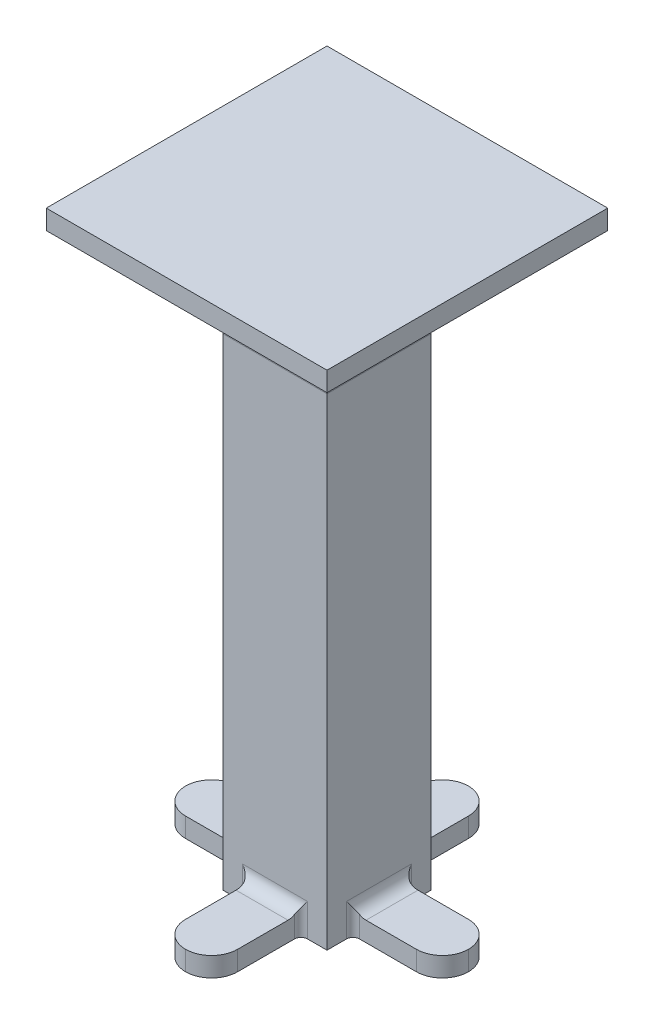
from build123d import *

# Parameters (mm, degrees)
SKETCH1_W           = 10.922
SKETCH1_H           = 12.7
SKETCH1_W_2         = 12.7
SKETCH1_H_2         = 10.922
BOSS_EXTRUDE1_DEPTH = 2.38125
SKETCH2_W           = 12.7
SKETCH2_H           = 12.7
BOSS_EXTRUDE2_DEPTH = 67.3862
SKETCH3_W           = 34.29
SKETCH3_H           = 34.29
BOSS_EXTRUDE3_DEPTH = 2.38125
FILLET15_R          = 10.922
SKETCH4_R           = 5.55625
CUT_EXTRUDE1_DEPTH  = 66.675
CUT_EXTRUDE2_REACH  = 78.171
SKETCH5_W           = 10.922
SKETCH5_H           = 3.175
SKETCH5_W_2         = 3.175
SKETCH5_H_2         = 10.922
FILLET18_R          = 3.175
FILLET28_R          = 0.79375
FILLET29_R          = 1.5875


# Some blends are built 0.0001 mm under size
with BuildPart() as part:
    # Sketch1 → Boss-Extrude1 (new body)
    with BuildSketch(Plane(origin=(0, 0, 0), x_dir=(1, 0, 0), z_dir=(0, 1, 0))):
        with Locations((-11.811, 0)):
            Rectangle(SKETCH1_W, SKETCH1_H)
        Rectangle(SKETCH1_W_2, SKETCH1_H)
        with Locations((0, 11.811)):
            Rectangle(SKETCH1_W_2, SKETCH1_H_2)
        with Locations((11.811, 0)):
            Rectangle(SKETCH1_W, SKETCH1_H)
        with Locations((0, -11.811)):
            Rectangle(SKETCH1_W_2, SKETCH1_H_2)
    extrude(amount=BOSS_EXTRUDE1_DEPTH)

    # Sketch2 → Boss-Extrude2 (add)
    with BuildSketch(Plane(origin=(0, 2.38125, 0), x_dir=(1, 0, 0), z_dir=(0, 1, 0))):
        Rectangle(SKETCH2_W, SKETCH2_H)
    extrude(amount=BOSS_EXTRUDE2_DEPTH)

    # Sketch3 → Boss-Extrude3 (add)
    with BuildSketch(Plane(origin=(0, 69.76745, 0), x_dir=(1, 0, 0), z_dir=(0, 1, 0))):
        Rectangle(SKETCH3_W, SKETCH3_H)
    extrude(amount=BOSS_EXTRUDE3_DEPTH)

    # Fillet15
    # the kernel refuses this fillet: 10.922 mm, written as the material it adds along each edge
    with BuildSketch(Plane(origin=(6.35, 69.76745, 6.35), x_dir=(1, 0, 0), z_dir=(0, 0, -1))) as fillet15_piece_1_section:
        with BuildLine():
            CenterArc((FILLET15_R, FILLET15_R), FILLET15_R, 180, 90)
            Line((0, FILLET15_R), (0, 0))
            Line((0, 0), (FILLET15_R, 0))
        make_face()
    fillet15_piece_1 = extrude(amount=12.7, mode=Mode.PRIVATE)
    fillet15_piece_1 = split(fillet15_piece_1, bisect_by=Plane(origin=(17.145, 67.292403203, 0), z_dir=(-1, 0, 0)), keep=Keep.TOP, mode=Mode.PRIVATE)
    add(fillet15_piece_1)
    with BuildSketch(Plane(origin=(6.35, 69.76745, -6.35), x_dir=(0, 0, -1), z_dir=(-1, 0, 0))) as fillet15_piece_2_section:
        with BuildLine():
            CenterArc((FILLET15_R, FILLET15_R), FILLET15_R, 180, 90)
            Line((0, FILLET15_R), (0, 0))
            Line((0, 0), (FILLET15_R, 0))
        make_face()
    fillet15_piece_2 = extrude(amount=12.7, mode=Mode.PRIVATE)
    fillet15_piece_2 = split(fillet15_piece_2, bisect_by=Plane(origin=(0, 67.292403203, -17.145), z_dir=(0, 0, 1)), keep=Keep.TOP, mode=Mode.PRIVATE)
    add(fillet15_piece_2)
    with BuildSketch(Plane(origin=(-6.35, 69.76745, -6.35), x_dir=(-1, 0, 0), z_dir=(0, 0, 1))) as fillet15_piece_3_section:
        with BuildLine():
            CenterArc((FILLET15_R, FILLET15_R), FILLET15_R, 180, 90)
            Line((0, FILLET15_R), (0, 0))
            Line((0, 0), (FILLET15_R, 0))
        make_face()
    fillet15_piece_3 = extrude(amount=12.7, mode=Mode.PRIVATE)
    fillet15_piece_3 = split(fillet15_piece_3, bisect_by=Plane(origin=(-17.145, 67.292403203, 0), z_dir=(1, 0, 0)), keep=Keep.TOP, mode=Mode.PRIVATE)
    add(fillet15_piece_3)
    with BuildSketch(Plane(origin=(-6.35, 69.76745, 6.35), x_dir=(0, 0, 1), z_dir=(1, 0, 0))) as fillet15_piece_4_section:
        with BuildLine():
            CenterArc((FILLET15_R, FILLET15_R), FILLET15_R, 180, 90)
            Line((0, FILLET15_R), (0, 0))
            Line((0, 0), (FILLET15_R, 0))
        make_face()
    fillet15_piece_4 = extrude(amount=12.7, mode=Mode.PRIVATE)
    fillet15_piece_4 = split(fillet15_piece_4, bisect_by=Plane(origin=(0, 67.292403203, 17.145), z_dir=(0, 0, -1)), keep=Keep.TOP, mode=Mode.PRIVATE)
    add(fillet15_piece_4)
    with BuildSketch(Plane(origin=(-6.35, 69.76745, 6.35), x_dir=(0, 0, 1), z_dir=(1, 0, 0))) as fillet15_piece_5a_section:
        with BuildLine():
            CenterArc((FILLET15_R, FILLET15_R), FILLET15_R, 180, 90)
            Line((0, FILLET15_R), (0, 0))
            Line((0, 0), (FILLET15_R, 0))
        make_face()
    fillet15_piece_5a = extrude(amount=40.005, mode=Mode.PRIVATE)
    fillet15_piece_5a = split(fillet15_piece_5a, bisect_by=Plane(origin=(11.7475, 67.292403203, 17.145), z_dir=(0, 0, -1)), keep=Keep.TOP, mode=Mode.PRIVATE)
    fillet15_piece_5a = split(fillet15_piece_5a, bisect_by=Plane(origin=(17.145, 67.292403203, 8.815024112), z_dir=(-1, 0, 0)), keep=Keep.TOP, mode=Mode.PRIVATE)
    fillet15_piece_5a = split(fillet15_piece_5a, bisect_by=Plane(origin=(6.35, 67.292403203, 8.815024112), z_dir=(1, 0, 0)), keep=Keep.TOP, mode=Mode.PRIVATE)
    with BuildSketch(Plane(origin=(6.35, 69.76745, 33.655), x_dir=(1, 0, 0), z_dir=(0, 0, -1))) as fillet15_piece_5b_section:
        with BuildLine():
            CenterArc((FILLET15_R, FILLET15_R), FILLET15_R, 180, 90)
            Line((0, FILLET15_R), (0, 0))
            Line((0, 0), (FILLET15_R, 0))
        make_face()
    fillet15_piece_5b = extrude(amount=40.005, mode=Mode.PRIVATE)
    fillet15_piece_5b = split(fillet15_piece_5b, bisect_by=Plane(origin=(8.815024112, 67.292403203, 17.145), z_dir=(0, 0, -1)), keep=Keep.TOP, mode=Mode.PRIVATE)
    fillet15_piece_5b = split(fillet15_piece_5b, bisect_by=Plane(origin=(17.145, 67.292403203, 11.7475), z_dir=(-1, 0, 0)), keep=Keep.TOP, mode=Mode.PRIVATE)
    fillet15_piece_5b = split(fillet15_piece_5b, bisect_by=Plane(origin=(8.815024112, 67.292403203, 6.35), z_dir=(0, 0, 1)), keep=Keep.TOP, mode=Mode.PRIVATE)
    fillet15_piece_5 = fillet15_piece_5a & fillet15_piece_5b
    add(fillet15_piece_5)
    with BuildSketch(Plane(origin=(6.35, 69.76745, 6.35), x_dir=(1, 0, 0), z_dir=(0, 0, -1))) as fillet15_piece_6a_section:
        with BuildLine():
            CenterArc((FILLET15_R, FILLET15_R), FILLET15_R, 180, 90)
            Line((0, FILLET15_R), (0, 0))
            Line((0, 0), (FILLET15_R, 0))
        make_face()
    fillet15_piece_6a = extrude(amount=40.005, mode=Mode.PRIVATE)
    fillet15_piece_6a = split(fillet15_piece_6a, bisect_by=Plane(origin=(17.145, 67.292403203, -11.7475), z_dir=(-1, 0, 0)), keep=Keep.TOP, mode=Mode.PRIVATE)
    fillet15_piece_6a = split(fillet15_piece_6a, bisect_by=Plane(origin=(8.815024112, 67.292403203, -17.145), z_dir=(0, 0, 1)), keep=Keep.TOP, mode=Mode.PRIVATE)
    fillet15_piece_6a = split(fillet15_piece_6a, bisect_by=Plane(origin=(8.815024112, 67.292403203, -6.35), z_dir=(0, 0, -1)), keep=Keep.TOP, mode=Mode.PRIVATE)
    with BuildSketch(Plane(origin=(33.655, 69.76745, -6.35), x_dir=(0, 0, -1), z_dir=(-1, 0, 0))) as fillet15_piece_6b_section:
        with BuildLine():
            CenterArc((FILLET15_R, FILLET15_R), FILLET15_R, 180, 90)
            Line((0, FILLET15_R), (0, 0))
            Line((0, 0), (FILLET15_R, 0))
        make_face()
    fillet15_piece_6b = extrude(amount=40.005, mode=Mode.PRIVATE)
    fillet15_piece_6b = split(fillet15_piece_6b, bisect_by=Plane(origin=(17.145, 67.292403203, -8.815024112), z_dir=(-1, 0, 0)), keep=Keep.TOP, mode=Mode.PRIVATE)
    fillet15_piece_6b = split(fillet15_piece_6b, bisect_by=Plane(origin=(11.7475, 67.292403203, -17.145), z_dir=(0, 0, 1)), keep=Keep.TOP, mode=Mode.PRIVATE)
    fillet15_piece_6b = split(fillet15_piece_6b, bisect_by=Plane(origin=(6.35, 67.292403203, -8.815024112), z_dir=(1, 0, 0)), keep=Keep.TOP, mode=Mode.PRIVATE)
    fillet15_piece_6 = fillet15_piece_6a & fillet15_piece_6b
    add(fillet15_piece_6)
    with BuildSketch(Plane(origin=(-6.35, 69.76745, -33.655), x_dir=(-1, 0, 0), z_dir=(0, 0, 1))) as fillet15_piece_7a_section:
        with BuildLine():
            CenterArc((FILLET15_R, FILLET15_R), FILLET15_R, 180, 90)
            Line((0, FILLET15_R), (0, 0))
            Line((0, 0), (FILLET15_R, 0))
        make_face()
    fillet15_piece_7a = extrude(amount=40.005, mode=Mode.PRIVATE)
    fillet15_piece_7a = split(fillet15_piece_7a, bisect_by=Plane(origin=(-17.145, 67.292403203, -11.7475), z_dir=(1, 0, 0)), keep=Keep.TOP, mode=Mode.PRIVATE)
    fillet15_piece_7a = split(fillet15_piece_7a, bisect_by=Plane(origin=(-8.815024112, 67.292403203, -17.145), z_dir=(0, 0, 1)), keep=Keep.TOP, mode=Mode.PRIVATE)
    fillet15_piece_7a = split(fillet15_piece_7a, bisect_by=Plane(origin=(-8.815024112, 67.292403203, -6.35), z_dir=(0, 0, -1)), keep=Keep.TOP, mode=Mode.PRIVATE)
    with BuildSketch(Plane(origin=(6.35, 69.76745, -6.35), x_dir=(0, 0, -1), z_dir=(-1, 0, 0))) as fillet15_piece_7b_section:
        with BuildLine():
            CenterArc((FILLET15_R, FILLET15_R), FILLET15_R, 180, 90)
            Line((0, FILLET15_R), (0, 0))
            Line((0, 0), (FILLET15_R, 0))
        make_face()
    fillet15_piece_7b = extrude(amount=40.005, mode=Mode.PRIVATE)
    fillet15_piece_7b = split(fillet15_piece_7b, bisect_by=Plane(origin=(-17.145, 67.292403203, -8.815024112), z_dir=(1, 0, 0)), keep=Keep.TOP, mode=Mode.PRIVATE)
    fillet15_piece_7b = split(fillet15_piece_7b, bisect_by=Plane(origin=(-11.7475, 67.292403203, -17.145), z_dir=(0, 0, 1)), keep=Keep.TOP, mode=Mode.PRIVATE)
    fillet15_piece_7b = split(fillet15_piece_7b, bisect_by=Plane(origin=(-6.35, 67.292403203, -8.815024112), z_dir=(-1, 0, 0)), keep=Keep.TOP, mode=Mode.PRIVATE)
    fillet15_piece_7 = fillet15_piece_7a & fillet15_piece_7b
    add(fillet15_piece_7)
    with BuildSketch(Plane(origin=(-6.35, 69.76745, -6.35), x_dir=(-1, 0, 0), z_dir=(0, 0, 1))) as fillet15_piece_8a_section:
        with BuildLine():
            CenterArc((FILLET15_R, FILLET15_R), FILLET15_R, 180, 90)
            Line((0, FILLET15_R), (0, 0))
            Line((0, 0), (FILLET15_R, 0))
        make_face()
    fillet15_piece_8a = extrude(amount=40.005, mode=Mode.PRIVATE)
    fillet15_piece_8a = split(fillet15_piece_8a, bisect_by=Plane(origin=(-8.815024112, 67.292403203, 17.145), z_dir=(0, 0, -1)), keep=Keep.TOP, mode=Mode.PRIVATE)
    fillet15_piece_8a = split(fillet15_piece_8a, bisect_by=Plane(origin=(-17.145, 67.292403203, 11.7475), z_dir=(1, 0, 0)), keep=Keep.TOP, mode=Mode.PRIVATE)
    fillet15_piece_8a = split(fillet15_piece_8a, bisect_by=Plane(origin=(-8.815024112, 67.292403203, 6.35), z_dir=(0, 0, 1)), keep=Keep.TOP, mode=Mode.PRIVATE)
    with BuildSketch(Plane(origin=(-33.655, 69.76745, 6.35), x_dir=(0, 0, 1), z_dir=(1, 0, 0))) as fillet15_piece_8b_section:
        with BuildLine():
            CenterArc((FILLET15_R, FILLET15_R), FILLET15_R, 180, 90)
            Line((0, FILLET15_R), (0, 0))
            Line((0, 0), (FILLET15_R, 0))
        make_face()
    fillet15_piece_8b = extrude(amount=40.005, mode=Mode.PRIVATE)
    fillet15_piece_8b = split(fillet15_piece_8b, bisect_by=Plane(origin=(-11.7475, 67.292403203, 17.145), z_dir=(0, 0, -1)), keep=Keep.TOP, mode=Mode.PRIVATE)
    fillet15_piece_8b = split(fillet15_piece_8b, bisect_by=Plane(origin=(-17.145, 67.292403203, 8.815024112), z_dir=(1, 0, 0)), keep=Keep.TOP, mode=Mode.PRIVATE)
    fillet15_piece_8b = split(fillet15_piece_8b, bisect_by=Plane(origin=(-6.35, 67.292403203, 8.815024112), z_dir=(-1, 0, 0)), keep=Keep.TOP, mode=Mode.PRIVATE)
    fillet15_piece_8 = fillet15_piece_8a & fillet15_piece_8b
    add(fillet15_piece_8)

    # Sketch4 → Cut-Extrude1 (cut)
    with BuildSketch(Plane.XZ):
        with Locations(Location((0, 0, 0), (0, 0, 270))):
            Circle(SKETCH4_R)
    extrude(amount=-CUT_EXTRUDE1_DEPTH, mode=Mode.SUBTRACT)

    # Sketch5 → Cut-Extrude2 (cut, up to next)
    with BuildSketch(Plane.XZ, mode=Mode.PRIVATE) as cut_extrude2_sk1:
        with Locations((-11.811, 4.7625)):
            Rectangle(SKETCH5_W, SKETCH5_H)
    cut_extrude2_tool1 = extrude(cut_extrude2_sk1.sketch, amount=-CUT_EXTRUDE2_REACH, mode=Mode.PRIVATE) & part.part
    # Sketch5 → Cut-Extrude2 (cut, up to next)
    with BuildSketch(Plane.XZ, mode=Mode.PRIVATE) as cut_extrude2_sk2:
        with Locations((-4.7625, 11.811)):
            Rectangle(SKETCH5_W_2, SKETCH5_H_2)
    cut_extrude2_tool2 = extrude(cut_extrude2_sk2.sketch, amount=-CUT_EXTRUDE2_REACH, mode=Mode.PRIVATE) & part.part
    # Sketch5 → Cut-Extrude2 (cut, up to next)
    with BuildSketch(Plane.XZ, mode=Mode.PRIVATE) as cut_extrude2_sk3:
        with Locations((4.7625, 11.811)):
            Rectangle(SKETCH5_W_2, SKETCH5_H_2)
    cut_extrude2_tool3 = extrude(cut_extrude2_sk3.sketch, amount=-CUT_EXTRUDE2_REACH, mode=Mode.PRIVATE) & part.part
    # Sketch5 → Cut-Extrude2 (cut, up to next)
    with BuildSketch(Plane.XZ, mode=Mode.PRIVATE) as cut_extrude2_sk4:
        with Locations((11.811, 4.7625)):
            Rectangle(SKETCH5_W, SKETCH5_H)
    cut_extrude2_tool4 = extrude(cut_extrude2_sk4.sketch, amount=-CUT_EXTRUDE2_REACH, mode=Mode.PRIVATE) & part.part
    # Sketch5 → Cut-Extrude2 (cut, up to next)
    with BuildSketch(Plane.XZ, mode=Mode.PRIVATE) as cut_extrude2_sk5:
        with Locations((11.811, -4.7625)):
            Rectangle(SKETCH5_W, SKETCH5_H)
    cut_extrude2_tool5 = extrude(cut_extrude2_sk5.sketch, amount=-CUT_EXTRUDE2_REACH, mode=Mode.PRIVATE) & part.part
    # Sketch5 → Cut-Extrude2 (cut, up to next)
    with BuildSketch(Plane.XZ, mode=Mode.PRIVATE) as cut_extrude2_sk6:
        with Locations((4.7625, -11.811)):
            Rectangle(SKETCH5_W_2, SKETCH5_H_2)
    cut_extrude2_tool6 = extrude(cut_extrude2_sk6.sketch, amount=-CUT_EXTRUDE2_REACH, mode=Mode.PRIVATE) & part.part
    # Sketch5 → Cut-Extrude2 (cut, up to next)
    with BuildSketch(Plane.XZ, mode=Mode.PRIVATE) as cut_extrude2_sk7:
        with Locations((-4.7625, -11.811)):
            Rectangle(SKETCH5_W_2, SKETCH5_H_2)
    cut_extrude2_tool7 = extrude(cut_extrude2_sk7.sketch, amount=-CUT_EXTRUDE2_REACH, mode=Mode.PRIVATE) & part.part
    # Sketch5 → Cut-Extrude2 (cut, up to next)
    with BuildSketch(Plane.XZ, mode=Mode.PRIVATE) as cut_extrude2_sk8:
        with Locations((-11.811, -4.7625)):
            Rectangle(SKETCH5_W, SKETCH5_H)
    cut_extrude2_tool8 = extrude(cut_extrude2_sk8.sketch, amount=-CUT_EXTRUDE2_REACH, mode=Mode.PRIVATE) & part.part
    add(cut_extrude2_tool1.solids().sort_by_distance((-11.811, 0, 4.7625))[0], mode=Mode.SUBTRACT)
    add(cut_extrude2_tool2.solids().sort_by_distance((-4.7625, 0, 11.811))[0], mode=Mode.SUBTRACT)
    add(cut_extrude2_tool3.solids().sort_by_distance((4.7625, 0, 11.811))[0], mode=Mode.SUBTRACT)
    add(cut_extrude2_tool4.solids().sort_by_distance((11.811, 0, 4.7625))[0], mode=Mode.SUBTRACT)
    add(cut_extrude2_tool5.solids().sort_by_distance((11.811, 0, -4.7625))[0], mode=Mode.SUBTRACT)
    add(cut_extrude2_tool6.solids().sort_by_distance((4.7625, 0, -11.811))[0], mode=Mode.SUBTRACT)
    add(cut_extrude2_tool7.solids().sort_by_distance((-4.7625, 0, -11.811))[0], mode=Mode.SUBTRACT)
    add(cut_extrude2_tool8.solids().sort_by_distance((-11.811, 0, -4.7625))[0], mode=Mode.SUBTRACT)

    # Fillet18
    fillet18_edges = [part.edges().sort_by_distance(p)[0] for p in [
        (-17.272, 1.190625, 3.175),
        (-17.272, 1.190625, -3.175),
        (-3.175, 1.190625, -17.272),
        (3.175, 1.190625, -17.272),
        (17.272, 1.190625, -3.175),
        (17.272, 1.190625, 3.175),
        (-3.175, 1.190625, 17.272),
        (3.175, 1.190625, 17.272),
    ]]
    fillet(fillet18_edges, radius=FILLET18_R - 0.0001)  # a hair under: the kernel refuses the full size

    # Fillet28
    fillet28_edges = [part.edges().sort_by_distance(p)[0] for p in [
        (-3.175, 1.190625, 6.35),
        (3.175, 1.190625, 6.35),
        (6.35, 1.190625, 3.175),
        (6.35, 1.190625, -3.175),
        (3.175, 1.190625, -6.35),
        (-3.175, 1.190625, -6.35),
        (-6.35, 1.190625, -3.175),
        (-6.35, 1.190625, 3.175),
    ]]
    fillet(fillet28_edges, radius=FILLET28_R)

    # Fillet29
    fillet29_edges = [part.edges().sort_by_distance(p)[0] for p in [
        (6.35, 2.38125, 0),
        (0, 2.38125, -6.35),
        (-6.35, 2.38125, 0),
        (0, 2.38125, 6.35),
    ]]
    fillet(fillet29_edges, radius=FILLET29_R)


solid = part.part
